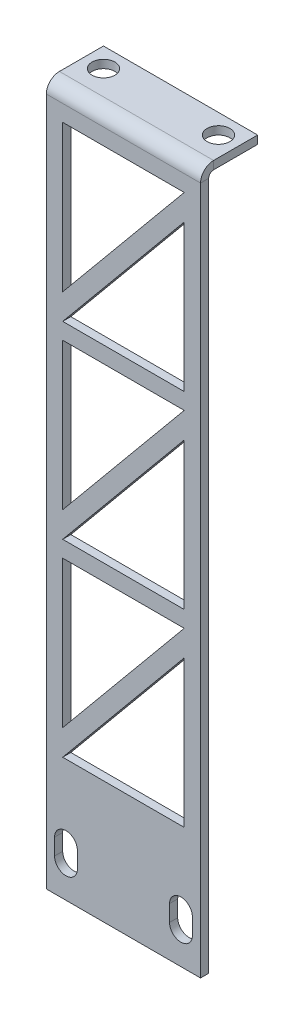
from build123d import *

# Parameters (mm, degrees)
SKETCH1_W                    = 18.9
SKETCH1_H                    = 85
BASE_FLANGE1_DEPTH           = 1
EDGE_FLANGE1_STRIP_W         = 5.2
EDGE_FLANGE1_STRIP_H         = 1
EDGE_FLANGE1_STRIP_CUT_DEPTH = 18.9
EDGE_FLANGE1_DEPTH           = 18.9
SKETCH9_R                    = 1.4
CUT_EXTRUDE1_DEPTH           = 10
CUT_EXTRUDE4_DEPTH           = 10


# Sheet-metal steps are written as plain solids
with BuildPart() as part:
    # Sketch1 → Base-Flange1 (new body)
    with BuildSketch(Plane.XY):
        Rectangle(SKETCH1_W, SKETCH1_H)
        with BuildLine():
            Line((-5.65, -36.5), (-5.65, -38.5))
            ThreePointArc((-5.65, -38.5), (-7.05, -39.9), (-8.45, -38.5))
            Line((-8.45, -38.5), (-8.45, -36.5))
            ThreePointArc((-8.45, -36.5), (-7.05, -35.1), (-5.65, -36.5))
        make_face(mode=Mode.SUBTRACT)
        with BuildLine():
            Line((8.45, -36.5), (8.45, -38.5))
            ThreePointArc((8.45, -38.5), (7.05, -39.9), (5.65, -38.5))
            Line((5.65, -38.5), (5.65, -36.5))
            ThreePointArc((5.65, -36.5), (7.05, -35.1), (8.45, -36.5))
        make_face(mode=Mode.SUBTRACT)
    extrude(amount=-BASE_FLANGE1_DEPTH)

    # Edge-Flange1 strip (across the edge) → Edge-Flange1 strip cut (cut)
    with BuildSketch(Plane(origin=(-9.45, 42.5, -1), x_dir=(0, -1, 0), z_dir=(1, 0, 0))):
        with Locations((-2, -0.5)):
            Rectangle(EDGE_FLANGE1_STRIP_W, EDGE_FLANGE1_STRIP_H)
    extrude(amount=EDGE_FLANGE1_STRIP_CUT_DEPTH, mode=Mode.SUBTRACT)

    # Edge-Flange1 section (across the edge) → Edge-Flange1 (add)
    with BuildSketch(Plane(origin=(-9.45, 42.5, -1), x_dir=(0, -1, 0), z_dir=(1, 0, 0))):
        with BuildLine():
            Line((-1, 0.6), (-1, 6))
            Line((-1, 6), (0, 6))
            Line((0, 6), (0, 0.6))
            ThreePointArc((0, 0.6), (0.175735931, 0.175735931), (0.6, 0))
            Line((0.6, 0), (0.6, -1))
            ThreePointArc((0.6, -1), (-0.53137085, -0.53137085), (-1, 0.6))
        make_face()
    extrude(amount=EDGE_FLANGE1_DEPTH)

    # Sketch9 → Cut-Extrude1 (cut)
    with BuildSketch(Plane(origin=(0, 43.5, 0), x_dir=(1, 0, 0), z_dir=(0, 1, 0))):
        with Locations(Location((-7.05, 4.6, 0), (0, 0, 270))):
            Circle(SKETCH9_R)
        with Locations(Location((7.05, 4.6, 0), (0, 0, 270))):
            Circle(SKETCH9_R)
    extrude(amount=-CUT_EXTRUDE1_DEPTH, mode=Mode.SUBTRACT)

    # Sketch12 → Cut-Extrude4 (cut)
    with BuildSketch(Plane.XY):
        Polygon((7.45, 39.9), (-7.45, 21.9), (-7.45, 39.9), align=None)
        Polygon((7.45, 36.763509145), (-7.45, 18.763509145), (7.45, 18.763509145), align=None)
        Polygon((-7.45, 16.763509145), (7.45, 16.763509145), (-7.45, -1.236490855), align=None)
        Polygon((7.45, 13.62701829), (-7.45, -4.37298171), (7.45, -4.37298171), align=None)
        Polygon((-7.45, -6.37298171), (7.45, -6.37298171), (-7.45, -24.37298171), align=None)
        Polygon((-7.45, -27.509472565), (7.45, -9.509472565), (7.45, -27.509472565), align=None)
    extrude(amount=-CUT_EXTRUDE4_DEPTH, mode=Mode.SUBTRACT)


solid = part.part
